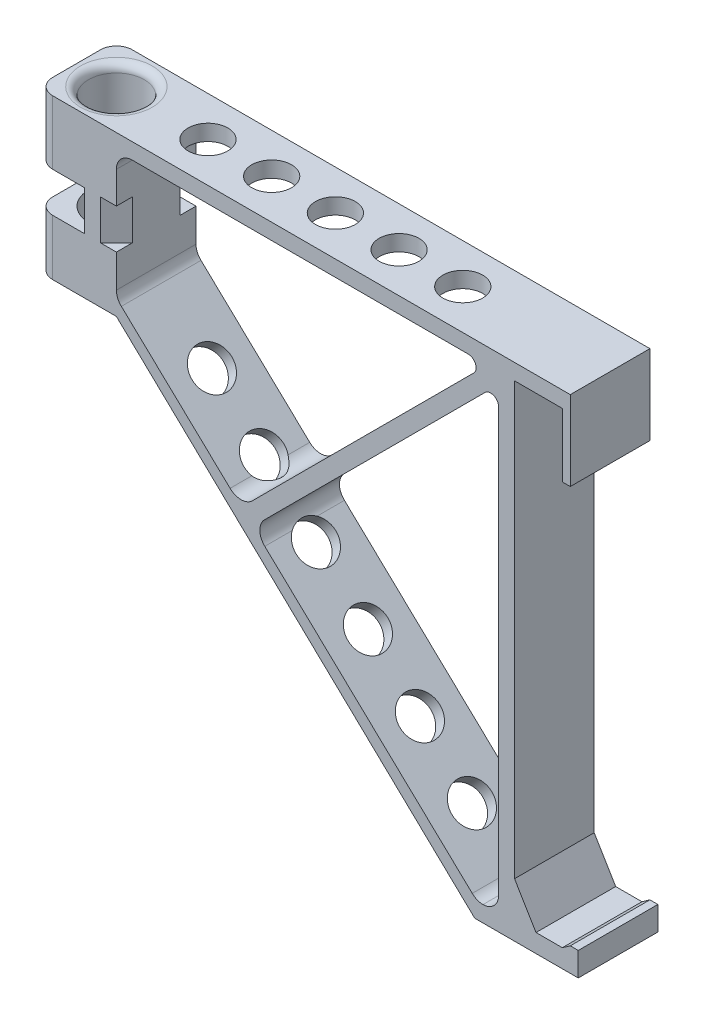
from build123d import *

# Parameters (mm, degrees)
FRAME_DEPTH         = 10
SKETCH13_R          = 3.5
CUT_EXTRUDE7_DEPTH  = 67.66634461
FILLET4_R           = 1
SKETCH14_W          = 5
SKETCH14_H          = 5
CUT_EXTRUDE8_DEPTH  = 81.777611378
FILLET5_R           = 2
CUT_EXTRUDE9_DEPTH  = 5
CHAMFER1_SIZE       = 1
FILLET6_R           = 2
FILLET7_R           = 1
CUT_EXTRUDE11_REACH = 59.656
SKETCH18_R          = 2.5
CUT_EXTRUDE12_REACH = 83.008
SKETCH19_R          = 2.5


with BuildPart() as part:
    # Sketch1 → Frame (new body)
    with BuildSketch(Plane.XY):
        Polygon((-8, 62.65), (49, 62.65), (49, 52.65), (48, 52.65), (48, 60.65), (42, 60.65), (42, 6.5), (44.7, 2), (48, 2), (49, 2.703504174), (50, 2.703504174), (50, -0.296495826), (37, -0.296495826), (-8, 42.65), (-18, 42.65), (-18, 62.65), align=None)
        Polygon((-8, 44.65), (-8, 60.65), (38.585786438, 60.65), (7.695355997, 29.759569559), align=None, mode=Mode.SUBTRACT)
        Polygon((40, 59.235786438), (40, 1.703504174), (37.268035971, 1.703504174), (9.146787391, 28.382573828), align=None, mode=Mode.SUBTRACT)
    extrude(amount=FRAME_DEPTH)

    # Sketch13 → Cut-Extrude7 (cut, through all)
    with BuildSketch(Plane.XZ.offset(-42.65)):
        with Locations(Location((-13, 5, 0), (0, 0, 270))):
            Circle(SKETCH13_R)
    extrude(amount=-CUT_EXTRUDE7_DEPTH, mode=Mode.SUBTRACT)

    # Fillet4
    fillet4_edges = [part.edges().sort_by_distance(p)[0] for p in [
        (-13, 62.65, 8.5),
        (-13, 42.65, 8.5),
    ]]
    fillet(fillet4_edges, radius=FILLET4_R)

    # Sketch14 → Cut-Extrude8 (cut, through all)
    with BuildSketch(Plane.XY.offset(10)):
        with Locations((-15.5, 52.15)):
            Rectangle(SKETCH14_W, SKETCH14_H)
    extrude(amount=-CUT_EXTRUDE8_DEPTH, mode=Mode.SUBTRACT)

    # Fillet5
    fillet5_edges = [part.edges().sort_by_distance(p)[0] for p in [
        (-18, 58.65, 0),
        (-18, 58.65, 10),
        (-18, 46.15, 0),
        (-18, 46.15, 10),
    ]]
    fillet(fillet5_edges, radius=FILLET5_R)

    # Sketch15 → Cut-Extrude9 (cut)
    with BuildSketch(Plane(origin=(0, 49.65, 0), x_dir=(1, 0, 0), z_dir=(0, 1, 0))):
        Polygon((-10, 0), (-8, -2), (-8, 0), align=None)
        Polygon((-10, -10), (-8, -8), (-8, -10), align=None)
    extrude(amount=CUT_EXTRUDE9_DEPTH, mode=Mode.SUBTRACT)

    # Chamfer1
    chamfer1_edges = [part.edges().sort_by_distance(p)[0] for p in [
        (-13, 52.15, 0),
        (-13, 52.15, 10),
    ]]
    chamfer(chamfer1_edges, length=CHAMFER1_SIZE)

    # Fillet6
    # the kernel refuses this fillet: 2 mm, written as the material it adds along each edge
    with BuildSketch(Plane(origin=(-8, 60.65, 0), x_dir=(0, -1, 0), z_dir=(0, 0, 1)), Plane(origin=(40, 1.703504174, 0), x_dir=(0, 1, 0), z_dir=(0, 0, 1))) as fillet6_piece_1:
        with BuildLine():
            CenterArc((FILLET6_R, FILLET6_R), FILLET6_R, 180, 90)
            Line((0, FILLET6_R), (0, 0))
            Line((0, 0), (FILLET6_R, 0))
        make_face()
    extrude(amount=10)
    with BuildSketch(Plane(origin=(37.268035971, 1.703504174, 0), x_dir=(1, 0, 0), z_dir=(0, 0, 1))) as fillet6_piece_2:
        with BuildLine():
            CenterArc((FILLET6_R * 0.398883640348, FILLET6_R), FILLET6_R, 226.507503973, 43.492496027)
            Line((-FILLET6_R * 0.289375927855, FILLET6_R * 0.274535482069), (0, 0))
            Line((0, 0), (FILLET6_R * 0.398883640348, 0))
        make_face()
    extrude(amount=10)
    with BuildSketch(Plane(origin=(-8, 44.65, 0), x_dir=(0, 1, 0), z_dir=(0, 0, 1))) as fillet6_piece_3:
        with BuildLine():
            CenterArc((FILLET6_R * 0.429711480151, -FILLET6_R), FILLET6_R, 90, 46.507503973)
            Line((-FILLET6_R * 0.29575303778, -FILLET6_R * 0.311740431797), (0, 0))
            Line((0, 0), (FILLET6_R * 0.429711480151, 0))
        make_face()
    extrude(amount=10)
    with BuildSketch(Plane(origin=(9.146787391, 28.382573828, 0), x_dir=(0.7254645179309741, -0.6882595682031448, 0), z_dir=(0, 0, 1))) as fillet6_piece_4:
        with BuildLine():
            CenterArc((FILLET6_R * 1.02666321267, FILLET6_R), FILLET6_R, 178.492496027, 91.507503973)
            Line((FILLET6_R * 0.0270093246389, FILLET6_R * 1.02630787225), (0, 0))
            Line((0, 0), (FILLET6_R * 1.02666321267, 0))
        make_face()
    extrude(amount=10)
    with BuildSketch(Plane(origin=(7.695355997, 29.759569559, 0), x_dir=(0.7071067811865478, 0.7071067811865474, 0), z_dir=(0, 0, 1))) as fillet6_piece_5:
        with BuildLine():
            CenterArc((FILLET6_R * 0.974029250934, FILLET6_R), FILLET6_R, 181.507503973, 88.492496027)
            Line((-FILLET6_R * 0.0256246370977, FILLET6_R * 0.973692127754), (0, 0))
            Line((0, 0), (FILLET6_R * 0.974029250934, 0))
        make_face()
    extrude(amount=10)

    # Fillet7
    fillet7_edges = [part.edges().sort_by_distance(p)[0] for p in [
        (38.585786438, 60.65, 5),
        (40, 59.235786438, 5),
    ]]
    fillet(fillet7_edges, radius=FILLET7_R)

    # Sketch18 → Cut-Extrude11 (cut, up to next)
    with BuildSketch(Plane(origin=(17.488453969, 18.324671512, 0), x_dir=(0.7234201739583832, -0.6904080329124386, 0), z_dir=(-0.6904080329124386, -0.7234201739583832, 0)), mode=Mode.PRIVATE) as cut_extrude11_sk1:
        with Locations((-26.968990252, 5)):
            Circle(SKETCH18_R)
    cut_extrude11_tool1 = extrude(cut_extrude11_sk1.sketch, amount=-CUT_EXTRUDE11_REACH, mode=Mode.PRIVATE) & part.part
    # Sketch18 → Cut-Extrude11 (cut, up to next)
    with BuildSketch(Plane(origin=(17.488453969, 18.324671512, 0), x_dir=(0.7234201739583832, -0.6904080329124386, 0), z_dir=(-0.6904080329124386, -0.7234201739583832, 0)), mode=Mode.PRIVATE) as cut_extrude11_sk2:
        with Locations((-17.968990252, 5)):
            Circle(SKETCH18_R)
    cut_extrude11_tool2 = extrude(cut_extrude11_sk2.sketch, amount=-CUT_EXTRUDE11_REACH, mode=Mode.PRIVATE) & part.part
    # Sketch18 → Cut-Extrude11 (cut, up to next)
    with BuildSketch(Plane(origin=(17.488453969, 18.324671512, 0), x_dir=(0.7234201739583832, -0.6904080329124386, 0), z_dir=(-0.6904080329124386, -0.7234201739583832, 0)), mode=Mode.PRIVATE) as cut_extrude11_sk3:
        with Locations((-8.968990252, 5)):
            Circle(SKETCH18_R)
    cut_extrude11_tool3 = extrude(cut_extrude11_sk3.sketch, amount=-CUT_EXTRUDE11_REACH, mode=Mode.PRIVATE) & part.part
    # Sketch18 → Cut-Extrude11 (cut, up to next)
    with BuildSketch(Plane(origin=(17.488453969, 18.324671512, 0), x_dir=(0.7234201739583832, -0.6904080329124386, 0), z_dir=(-0.6904080329124386, -0.7234201739583832, 0)), mode=Mode.PRIVATE) as cut_extrude11_sk4:
        with Locations((0.031009748, 5)):
            Circle(SKETCH18_R)
    cut_extrude11_tool4 = extrude(cut_extrude11_sk4.sketch, amount=-CUT_EXTRUDE11_REACH, mode=Mode.PRIVATE) & part.part
    # Sketch18 → Cut-Extrude11 (cut, up to next)
    with BuildSketch(Plane(origin=(17.488453969, 18.324671512, 0), x_dir=(0.7234201739583832, -0.6904080329124386, 0), z_dir=(-0.6904080329124386, -0.7234201739583832, 0)), mode=Mode.PRIVATE) as cut_extrude11_sk5:
        with Locations((9.031009748, 5)):
            Circle(SKETCH18_R)
    cut_extrude11_tool5 = extrude(cut_extrude11_sk5.sketch, amount=-CUT_EXTRUDE11_REACH, mode=Mode.PRIVATE) & part.part
    # Sketch18 → Cut-Extrude11 (cut, up to next)
    with BuildSketch(Plane(origin=(17.488453969, 18.324671512, 0), x_dir=(0.7234201739583832, -0.6904080329124386, 0), z_dir=(-0.6904080329124386, -0.7234201739583832, 0)), mode=Mode.PRIVATE) as cut_extrude11_sk6:
        with Locations((18.031009748, 5)):
            Circle(SKETCH18_R)
    cut_extrude11_tool6 = extrude(cut_extrude11_sk6.sketch, amount=-CUT_EXTRUDE11_REACH, mode=Mode.PRIVATE) & part.part
    add(cut_extrude11_tool1.solids().sort_by_distance((-2.021458, 36.944279, 5))[0], mode=Mode.SUBTRACT)
    add(cut_extrude11_tool2.solids().sort_by_distance((4.489324, 30.730607, 5))[0], mode=Mode.SUBTRACT)
    add(cut_extrude11_tool3.solids().sort_by_distance((11.000105, 24.516934, 5))[0], mode=Mode.SUBTRACT)
    add(cut_extrude11_tool4.solids().sort_by_distance((17.510887, 18.303262, 5))[0], mode=Mode.SUBTRACT)
    add(cut_extrude11_tool5.solids().sort_by_distance((24.021669, 12.08959, 5))[0], mode=Mode.SUBTRACT)
    add(cut_extrude11_tool6.solids().sort_by_distance((30.53245, 5.875918, 5))[0], mode=Mode.SUBTRACT)

    # Sketch19 → Cut-Extrude12 (cut, up to next)
    with BuildSketch(Plane(origin=(0, 62.65, 0), x_dir=(1, 0, 0), z_dir=(0, 1, 0)), mode=Mode.PRIVATE) as cut_extrude12_sk1:
        with Locations(Location((-1.5, -5, 0), (0, 0, 180))):
            Circle(SKETCH19_R)
    cut_extrude12_tool1 = extrude(cut_extrude12_sk1.sketch, amount=-CUT_EXTRUDE12_REACH, mode=Mode.PRIVATE) & part.part
    # Sketch19 → Cut-Extrude12 (cut, up to next)
    with BuildSketch(Plane(origin=(0, 62.65, 0), x_dir=(1, 0, 0), z_dir=(0, 1, 0)), mode=Mode.PRIVATE) as cut_extrude12_sk2:
        with Locations(Location((6.5, -5, 0), (0, 0, 180))):
            Circle(SKETCH19_R)
    cut_extrude12_tool2 = extrude(cut_extrude12_sk2.sketch, amount=-CUT_EXTRUDE12_REACH, mode=Mode.PRIVATE) & part.part
    # Sketch19 → Cut-Extrude12 (cut, up to next)
    with BuildSketch(Plane(origin=(0, 62.65, 0), x_dir=(1, 0, 0), z_dir=(0, 1, 0)), mode=Mode.PRIVATE) as cut_extrude12_sk3:
        with Locations(Location((14.5, -5, 0), (0, 0, 180))):
            Circle(SKETCH19_R)
    cut_extrude12_tool3 = extrude(cut_extrude12_sk3.sketch, amount=-CUT_EXTRUDE12_REACH, mode=Mode.PRIVATE) & part.part
    # Sketch19 → Cut-Extrude12 (cut, up to next)
    with BuildSketch(Plane(origin=(0, 62.65, 0), x_dir=(1, 0, 0), z_dir=(0, 1, 0)), mode=Mode.PRIVATE) as cut_extrude12_sk4:
        with Locations(Location((22.5, -5, 0), (0, 0, 180))):
            Circle(SKETCH19_R)
    cut_extrude12_tool4 = extrude(cut_extrude12_sk4.sketch, amount=-CUT_EXTRUDE12_REACH, mode=Mode.PRIVATE) & part.part
    # Sketch19 → Cut-Extrude12 (cut, up to next)
    with BuildSketch(Plane(origin=(0, 62.65, 0), x_dir=(1, 0, 0), z_dir=(0, 1, 0)), mode=Mode.PRIVATE) as cut_extrude12_sk5:
        with Locations(Location((30.5, -5, 0), (0, 0, 180))):
            Circle(SKETCH19_R)
    cut_extrude12_tool5 = extrude(cut_extrude12_sk5.sketch, amount=-CUT_EXTRUDE12_REACH, mode=Mode.PRIVATE) & part.part
    add(cut_extrude12_tool1.solids().sort_by_distance((-1.5, 62.65, 5))[0], mode=Mode.SUBTRACT)
    add(cut_extrude12_tool2.solids().sort_by_distance((6.5, 62.65, 5))[0], mode=Mode.SUBTRACT)
    add(cut_extrude12_tool3.solids().sort_by_distance((14.5, 62.65, 5))[0], mode=Mode.SUBTRACT)
    add(cut_extrude12_tool4.solids().sort_by_distance((22.5, 62.65, 5))[0], mode=Mode.SUBTRACT)
    add(cut_extrude12_tool5.solids().sort_by_distance((30.5, 62.65, 5))[0], mode=Mode.SUBTRACT)


solid = part.part
